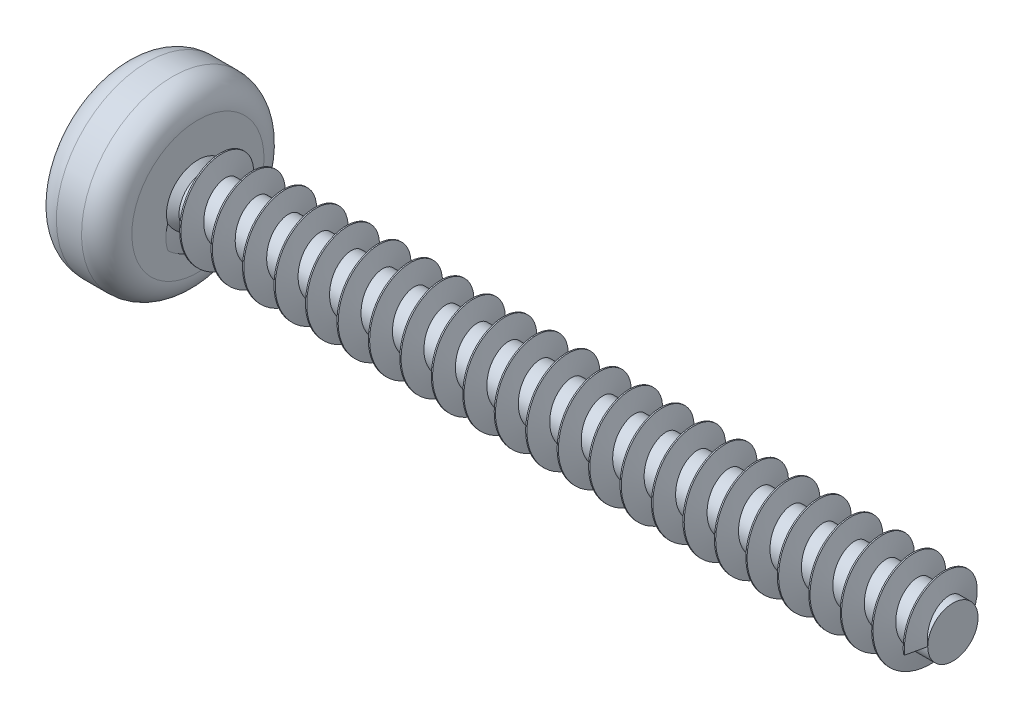
from build123d import *
from build123d.topology import SkipClean

# Parameters (mm, degrees)
SKETCH2_W                    = 0.4
SKETCH2_H                    = 1.7
CUT_EXTRUDE1_DEPTH           = 0.8
CUT_EXTRUDE1_DRAFT           = -9
SKETCH2_W_2                  = 1.7
SKETCH2_H_2                  = 0.4
CUT_EXTRUDE1_PROFILE_2_DEPTH = 0.8
CUT_EXTRUDE1_PROFILE_2_DRAFT = -9
THREAD3_PITCH                = 0.5


with BuildPart() as part:
    # Sketch1 → Revolve1 (revolve)
    with BuildSketch(Plane.XY):
        with BuildLine():
            Line((0, 0), (0, 1.05))
            ThreePointArc((0, 1.05), (0.117157288, 1.332842712), (0.4, 1.45))
            Line((0.4, 1.45), (0.8, 1.45))
            ThreePointArc((0.8, 1.45), (1.082842712, 1.332842712), (1.2, 1.05))
            Line((1.2, 1.05), (1.2, 0.5))
            Line((1.2, 0.5), (1.3, 0.4))
            Line((1.3, 0.4), (13.2, 0.4))
            Line((13.2, 0.4), (13.2, 0))
            Line((13.2, 0), (0, 0))
        make_face()
    revolve(axis=Axis((13.2, 0, 0), (-1, 0, 0)))


with BuildPart() as cut_extrude1_tool:
    # Sketch2 → Cut-Extrude1 (with draft: the straight prism first)
    with BuildSketch(Plane.ZY):
        Rectangle(SKETCH2_W, SKETCH2_H)
    extrude(amount=-CUT_EXTRUDE1_DEPTH)
    # Cut-Extrude1: the draft: its side faces are tilted about the plane it starts from
    cut_extrude1_sides = [cut_extrude1_tool.faces().sort_by_distance(p)[0] for p in [
        (0.4, 0, 0.2),
        (0.4, 0.85, 0),
        (0.4, 0, -0.2),
        (0.4, -0.85, 0),
    ]]
    draft(cut_extrude1_sides, Plane.ZY, CUT_EXTRUDE1_DRAFT)


with BuildPart() as part_1:
    add(part.part)

    # Cut-Extrude1: cut by cut_extrude1_tool
    add(cut_extrude1_tool.part, mode=Mode.SUBTRACT)


with BuildPart() as cut_extrude1_profile_2_tool:
    # Sketch2 → Cut-Extrude1 profile 2 (with draft: the straight prism first)
    with BuildSketch(Plane.ZY):
        Rectangle(SKETCH2_W_2, SKETCH2_H_2)
    extrude(amount=-CUT_EXTRUDE1_PROFILE_2_DEPTH)
    # Cut-Extrude1 profile 2: the draft: its side faces are tilted about the plane it starts from
    cut_extrude1_profile_2_sides = [cut_extrude1_profile_2_tool.faces().sort_by_distance(p)[0] for p in [
        (0.4, 0.2, 0),
        (0.4, 0, -0.85),
        (0.4, -0.2, 0),
        (0.4, 0, 0.85),
    ]]
    draft(cut_extrude1_profile_2_sides, Plane.ZY, CUT_EXTRUDE1_PROFILE_2_DRAFT)


with BuildPart() as part_2:
    add(part_1.part)

    # Cut-Extrude1 profile 2: cut by cut_extrude1_profile_2_tool
    add(cut_extrude1_profile_2_tool.part, mode=Mode.SUBTRACT)

    # Thread3: the profile of Thread Profile4 profile screwed along a right-hand helix of 24 turns, 6 arcs to a turn; built about Z, then put on its axis
    with SkipClean():  # the faces are left unmerged after this step: merging them gives an invalid solid
        thread3_z = Axis((0, 0, 0), (0, 0, 1))
        thread3_corners = [(0.3997, 0, -6.6508e-05), (0.7, 0, 0.066508399), (0.7, 0, 0.086508399), (0.3997, 0, 0.153083306)]
        with BuildLine(mode=Mode.PRIVATE) as thread3_profile:
            Line(thread3_corners[0], thread3_corners[1])
            Line(thread3_corners[1], thread3_corners[2])
            Line(thread3_corners[2], thread3_corners[3])
            Line(thread3_corners[3], thread3_corners[0])
        thread3_cap = Face(thread3_profile.wire())
        thread3_turn_angles = [0, 30, 60, 90, 120, 150, 180, 210, 240, 270, 300, 330, 360]
        thread3_turn_weights = [1, 0.8660254037844387, 1, 0.8660254037844387, 1, 0.8660254037844387, 1, 0.8660254037844387, 1, 0.8660254037844387, 1, 0.8660254037844387, 1]
        thread3_turn_rails = [Edge.make_bspline([Vector(p[0], p[1], 0).rotate(thread3_z, thread3_turn_angles[k]) / thread3_turn_weights[k] + Vector(0, 0, p[2] + THREAD3_PITCH * thread3_turn_angles[k] / 360) for k in range(13)], [0, 0, 0, 1, 1, 2, 2, 3, 3, 4, 4, 5, 5, 6, 6, 6], 2, thread3_turn_weights) for p in thread3_corners]
        thread3_turn_sides = [Face.make_surface_from_curves(thread3_turn_rails[p[0]], thread3_turn_rails[p[1]]) for p in [(0, 1), (1, 2), (2, 3), (3, 0)]]
        thread3 = Plane(origin=(13.2, 0, 0), x_dir=(0, 0, 1), z_dir=(-1, 0, 0)) * Solid(Shell([*[p.moved(Location((0, 0, THREAD3_PITCH * i))) for i in range(24) for p in thread3_turn_sides], thread3_cap, thread3_cap.rotate(thread3_z, 8640).moved(Location((0, 0, THREAD3_PITCH * 8640 / 360)))]))
        add(thread3)


solid = part_2.part
